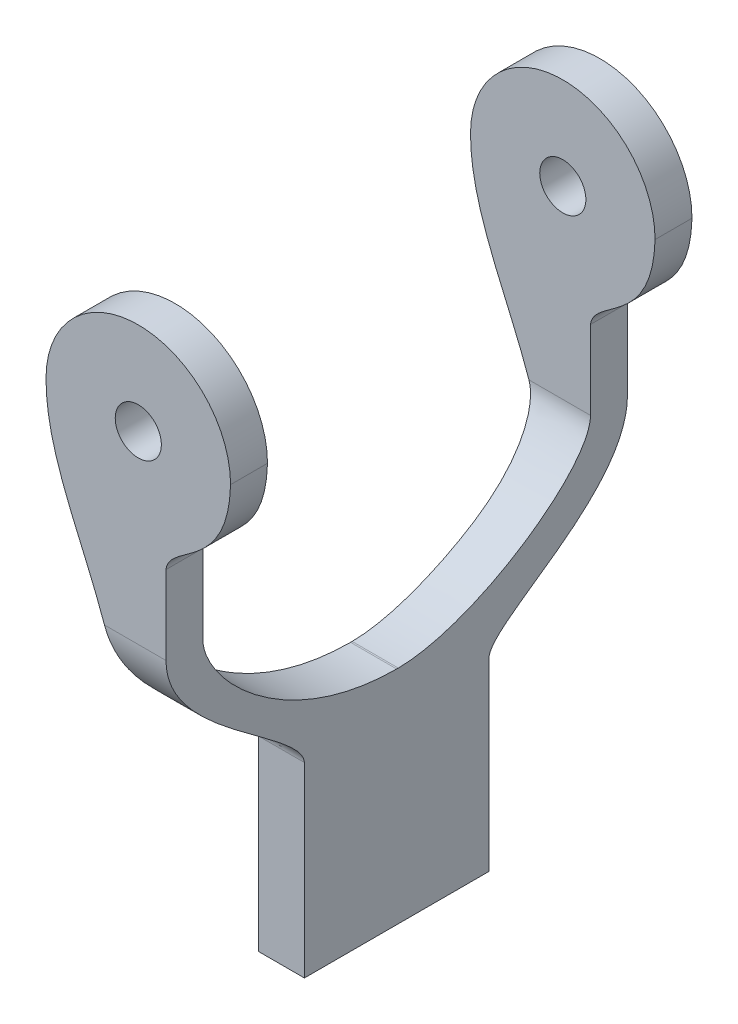
from build123d import *

# Parameters (mm, degrees)
BOSS_EXTRU_1_DEPTH      = 50
ENL_V_START             = -13.000137383
ENL_V_MAT_EXTRU_1_DEPTH = 20.000137383


# Read off the part's stored shape, not the designer's step: Enlèv. mat.-Extru.1
with BuildPart() as part:
    # Esquisse1 → Boss.-Extru.1 (new body)
    with BuildSketch(Plane.XY.offset(-25)):
        with BuildLine():
            Line((-2, -28.65), (-2, -9.797958971))
            ThreePointArc((-2, -9.797958971), (-7.745966692, -6.32455532), (-10, 0))
            add(Edge.make_bspline(
                [(-10, 0), (-10.038102543, -9.915248827), (-2.132148039, -18.010708935), (-2, -28.65)],
                knots=[0, 0, 0, 0, 1, 1, 1, 1], degree=3))
        make_face()
        with BuildLine():
            Line((3, -11.472816521), (3, -9.539392014))
            ThreePointArc((3, -9.539392014), (0.516443819, -9.986655385), (-2, -9.797958971))
            Line((-2, -9.797958971), (-2, -28.65))
            Line((-2, -28.65), (-2, -57.3))
            Line((-2, -57.3), (3, -57.3))
            Line((3, -57.3), (3, -11.472816521))
        make_face()
        with BuildLine():
            ThreePointArc((9.899806533, -1.412030667), (7.623303271, -6.471881275), (3, -9.539392014))
            Line((3, -9.539392014), (3, -11.472816521))
            add(Edge.make_bspline(
                [(9.899806533, -1.412030667), (9.042464712, -8.684319248), (3.317345852, -8.787272714), (3, -11.472816521)],
                knots=[0.05745519, 0.05745519, 0.05745519, 0.05745519, 1, 1, 1, 1], degree=3))
        make_face()
        with BuildLine():
            ThreePointArc((-2, -1.5), (-0.790569415, 2.371708245), (2.5, 0))
            Line((2.5, 0), (3, 0))
            Line((3, 0), (3, -9.539392014))
            ThreePointArc((3, -9.539392014), (7.623303271, -6.471881275), (9.899806533, -1.412030667))
            add(Edge.make_bspline(
                [(10, 0), (9.986241611, -0.498789425), (9.952067961, -0.968730021), (9.899806533, -1.412030667)],
                knots=[0, 0, 0, 0, 0.05745519, 0.05745519, 0.05745519, 0.05745519], degree=3))
            ThreePointArc((10, 0), (0, 10), (-10, 0))
            ThreePointArc((-10, 0), (-7.745966692, -6.32455532), (-2, -9.797958971))
            Line((-2, -9.797958971), (-2, -1.5))
        make_face()
        with BuildLine():
            Line((3, 0), (2.5, 0))
            ThreePointArc((2.5, 0), (0.790569415, -2.371708245), (-2, -1.5))
            Line((-2, -1.5), (-2, -9.797958971))
            ThreePointArc((-2, -9.797958971), (0.516443819, -9.986655385), (3, -9.539392014))
            Line((3, -9.539392014), (3, 0))
        make_face()
    extrude(amount=BOSS_EXTRU_1_DEPTH)

    # Enlèv. mat.-Extru.1 outline → Enlèv. mat.-Extru.1 (cut)
    with BuildSketch(Plane(origin=(3, 0, 0), x_dir=(0, 0, -1), z_dir=(1, 0, 0)).offset(ENL_V_START)):
        with BuildLine():
            Line((-25, -57.3), (-10, -57.3))
            Line((-10, -57.3), (-10, -37.083079187))
            add(Edge.make_bspline(
                [(-10, -37.083079187), (-10.308820918, -33.626949696), (-24.959081539, -27.805521116), (-25, -20.002816521)],
                knots=[0.33438903, 0.33438903, 0.33438903, 0.33438903, 1.313600201, 1.313600201, 1.313600201, 1.313600201], degree=3))
            Line((-25, -20.002816521), (-25, -57.3))
        make_face()
        with BuildLine():
            Line((10, -37.3), (10, -57.3))
            Line((10, -57.3), (25, -57.3))
            Line((25, -57.3), (25, -20.310673404))
            add(Edge.make_bspline(
                [(25, -20.310673404), (24.825306853, -28.916467162), (10.047414043, -34.103142781), (10, -37.3)],
                knots=[0.656671032, 0.656671032, 0.656671032, 0.656671032, 1.644941889, 1.644941889, 1.644941889, 1.644941889], degree=3))
        make_face()
        with BuildLine():
            add(Edge.make_bspline(
                [(0.174087167, -33.300000001), (8.510773732, -33.241503729), (20.989133498, -24.836380481), (20.999995082, -20.00281651)],
                knots=[0.00693536, 0.00693536, 0.00693536, 0.00693536, 0.999807124, 0.999807124, 0.999807124, 0.999807124], degree=3))
            Line((20.999995082, -20.00281651), (21, 10.000000033))
            Line((21, 10.000000033), (-21, 10))
            Line((-21, 10), (-21.000000005, -20.035970331))
            add(Edge.make_bspline(
                [(0, -33.3), (-12.278821067, -33.266087617), (-20.974999639, -24.210992728), (-21.000000005, -20.035970331)],
                knots=[0, 0, 0, 0, 0.99712668, 0.99712668, 0.99712668, 0.99712668], degree=3))
            Line((0, -33.3), (0.174087167, -33.300000001))
        make_face()
    extrude(amount=ENL_V_MAT_EXTRU_1_DEPTH, mode=Mode.SUBTRACT)


solid = part.part
